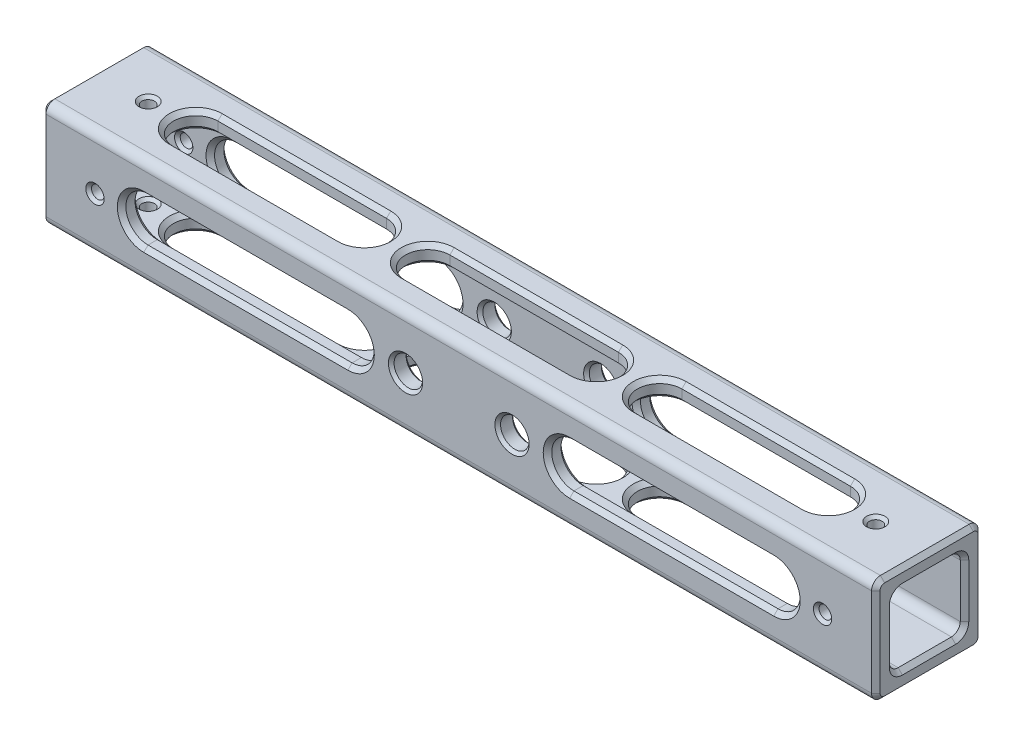
from build123d import *

# Parameters (mm, degrees)
SKETCH1_W                          = 19.05
SKETCH1_H                          = 19.05
SKETCH1_W_2                        = 12.7
SKETCH1_H_2                        = 12.7
BOSS_EXTRUDE1_DEPTH                = 74.6125
F_1_4_20_TAPPED_HOLE1_D            = 5.1054
F_4_40_TAPPED_HOLE1_D              = 2.2606
F_4_40_TAPPED_HOLE2_D              = 2.2606
F_5_16_START                       = -9.525
F_5_16_0_3125_DIAMETER_SLOT1_DEPTH = 19.05
F_5_16_0_3125_DIAMETER_SLOT2_DEPTH = 19.05
FILLET1_R                          = 1.5875
CHAMFER2_SIZE                      = 0.762
CHAMFER1_SIZE                      = 0.508


# Read off the part's stored shape, not the designer's step: 5/16 (0.3125) Diameter Slot1, 5/16 (0.3125) Diameter Slot2
with BuildPart() as part:
    # Sketch1 → Boss-Extrude1 (new, symmetric)
    with BuildSketch(Plane(origin=(0, 0, 0), x_dir=(0, 0, -1), z_dir=(1, 0, 0))):
        Rectangle(SKETCH1_W, SKETCH1_H)
        Rectangle(SKETCH1_W_2, SKETCH1_H_2, mode=Mode.SUBTRACT)
    extrude(amount=BOSS_EXTRUDE1_DEPTH, both=True)

    # 1/4-20 Tapped Hole1 (through all)
    with Locations(Plane.XY.offset(9.525)):
        with Locations((-9.525, 0), (9.525, 0)):
            Hole(F_1_4_20_TAPPED_HOLE1_D / 2)

    # #4-40 Tapped Hole1 (through all)
    with Locations(Plane.XY.offset(9.525)):
        with Locations((65.0875, 0), (-65.0875, 0)):
            Hole(F_4_40_TAPPED_HOLE1_D / 2)

    # #4-40 Tapped Hole2 (through all)
    with Locations(Plane(origin=(0, 9.525, 0), x_dir=(1, 0, 0), z_dir=(0, 1, 0))):
        with Locations((65.0875, 0), (-65.0875, 0)):
            Hole(F_4_40_TAPPED_HOLE2_D / 2)

    # 5/16 (0.3125) Diameter Slot1 outline → 5/16 (0.3125) Diameter Slot1 (cut)
    with BuildSketch(Plane.XY.offset(F_5_16_START)):
        with BuildLine():
            ThreePointArc((56.35625, -3.96875), (60.325, 0), (56.35625, 3.96875))
            Line((56.35625, 3.96875), (19.84375, 3.96875))
            ThreePointArc((19.84375, 3.96875), (15.875, 0), (19.84375, -3.96875))
            Line((19.84375, -3.96875), (56.35625, -3.96875))
        make_face()
        with BuildLine():
            ThreePointArc((-19.84375, -3.96875), (-15.875, 0), (-19.84375, 3.96875))
            Line((-19.84375, 3.96875), (-56.35625, 3.96875))
            ThreePointArc((-56.35625, 3.96875), (-60.325, 0), (-56.35625, -3.96875))
            Line((-56.35625, -3.96875), (-19.84375, -3.96875))
        make_face()
    extrude(amount=F_5_16_0_3125_DIAMETER_SLOT1_DEPTH, mode=Mode.SUBTRACT)

    # 5/16 (0.3125) Diameter Slot2 outline → 5/16 (0.3125) Diameter Slot2 (cut)
    with BuildSketch(Plane(origin=(0, 0, 0), x_dir=(1, 0, 0), z_dir=(0, 1, 0)).offset(F_5_16_START)):
        with BuildLine():
            ThreePointArc((26.42235, 3.96875), (22.4536, 0), (26.42235, -3.96875))
            Line((26.42235, -3.96875), (56.58485, -3.96875))
            ThreePointArc((56.58485, -3.96875), (60.5536, 0), (56.58485, 3.96875))
            Line((56.58485, 3.96875), (26.42235, 3.96875))
        make_face()
        with BuildLine():
            ThreePointArc((-26.42235, -3.96875), (-22.4536, 0), (-26.42235, 3.96875))
            Line((-26.42235, 3.96875), (-56.58485, 3.96875))
            ThreePointArc((-56.58485, 3.96875), (-60.5536, 0), (-56.58485, -3.96875))
            Line((-56.58485, -3.96875), (-26.42235, -3.96875))
        make_face()
        with BuildLine():
            ThreePointArc((15.08125, -3.96875), (19.05, 0), (15.08125, 3.96875))
            Line((15.08125, 3.96875), (-15.08125, 3.96875))
            ThreePointArc((-15.08125, 3.96875), (-19.05, 0), (-15.08125, -3.96875))
            Line((-15.08125, -3.96875), (15.08125, -3.96875))
        make_face()
    extrude(amount=F_5_16_0_3125_DIAMETER_SLOT2_DEPTH, mode=Mode.SUBTRACT)

    # Fillet1
    fillet1_edges = [part.edges().sort_by_distance(p)[0] for p in [
        (0, -6.35, -6.35),
        (0, 6.35, -6.35),
        (0, 6.35, 6.35),
        (0, -6.35, 6.35),
        (0, -9.525, -9.525),
        (0, -9.525, 9.525),
        (0, 9.525, 9.525),
        (0, 9.525, -9.525),
    ]]
    fillet(fillet1_edges, radius=FILLET1_R)

    # Chamfer2
    chamfer2_edges = [part.edges().sort_by_distance(p)[0] for p in [
        (15.875, 0, 9.525),
        (38.1, 3.96875, -9.525),
        (-38.1, 3.96875, 6.35),
        (-15.875, 0, 6.35),
        (-38.1, -3.96875, 6.35),
        (-15.875, 0, -6.35),
        (-15.875, 0, -9.525),
        (-38.1, -3.96875, -6.35),
        (-38.1, -3.96875, -9.525),
        (-38.1, 3.96875, -6.35),
        (-60.325, 0, -6.35),
        (-60.325, 0, 6.35),
        (-60.325, 0, -9.525),
        (-38.1, -3.96875, 9.525),
        (-15.875, 0, 9.525),
        (-60.325, 0, 9.525),
        (-38.1, 3.96875, -9.525),
        (-38.1, 3.96875, 9.525),
        (41.5036, -6.35, -3.96875),
        (60.5536, -6.35, 0),
        (22.4536, -6.35, 0),
        (41.5036, -6.35, 3.96875),
        (60.5536, 6.35, 0),
        (41.5036, 6.35, 3.96875),
        (22.4536, 6.35, 0),
        (22.4536, 9.525, 0),
        (41.5036, 6.35, -3.96875),
        (41.5036, 9.525, -3.96875),
        (41.5036, -9.525, -3.96875),
        (60.5536, -9.525, 0),
        (22.4536, -9.525, 0),
        (41.5036, 9.525, 3.96875),
        (60.5536, 9.525, 0),
        (41.5036, -9.525, 3.96875),
        (-41.5036, 6.35, -3.96875),
        (-22.4536, 6.35, 0),
        (-60.5536, 6.35, 0),
        (-41.5036, 6.35, 3.96875),
        (-60.5536, -6.35, 0),
        (-22.4536, -6.35, 0),
        (-22.4536, 9.525, 0),
        (-60.5536, 9.525, 0),
        (-41.5036, -6.35, 3.96875),
        (-41.5036, -9.525, 3.96875),
        (-41.5036, -6.35, -3.96875),
        (-41.5036, -9.525, -3.96875),
        (-22.4536, -9.525, 0),
        (-60.5536, -9.525, 0),
        (-41.5036, 9.525, 3.96875),
        (-41.5036, 9.525, -3.96875),
        (-19.05, -6.35, 0),
        (19.05, -6.35, 0),
        (0, -6.35, -3.96875),
        (0, 6.35, -3.96875),
        (0, 9.525, -3.96875),
        (19.05, 6.35, 0),
        (19.05, 9.525, 0),
        (-19.05, 6.35, 0),
        (-19.05, 9.525, 0),
        (0, 6.35, 3.96875),
        (0, -6.35, 3.96875),
        (0, -9.525, -3.96875),
        (19.05, -9.525, 0),
        (-19.05, -9.525, 0),
        (0, 9.525, 3.96875),
        (0, -9.525, 3.96875),
        (-74.6125, 0, -6.35),
        (74.6125, 0, -6.35),
        (-74.6125, 6.35, 0),
        (74.6125, 6.35, 0),
        (-74.6125, -6.35, 0),
        (74.6125, -6.35, 0),
        (-74.6125, 0, 6.35),
        (74.6125, 0, 6.35),
        (-74.6125, 0, -9.525),
        (74.6125, 0, -9.525),
        (-74.6125, -9.525, 0),
        (-74.6125, 0, 9.525),
        (-74.6125, 9.525, 0),
        (-74.6125, 9.060032015, 9.060032015),
        (-74.6125, 9.060032015, -9.060032015),
        (-74.6125, -9.060032015, 9.060032015),
        (-74.6125, -9.060032015, -9.060032015),
        (74.6125, -9.525, 0),
        (74.6125, 9.525, 0),
        (74.6125, 0, 9.525),
        (74.6125, 9.060032015, 9.060032015),
        (74.6125, 9.060032015, -9.060032015),
        (74.6125, -9.060032015, 9.060032015),
        (74.6125, -9.060032015, -9.060032015),
        (-74.6125, 5.885032015, -5.885032015),
        (74.6125, 5.885032015, -5.885032015),
        (-74.6125, -5.885032015, -5.885032015),
        (74.6125, -5.885032015, -5.885032015),
        (-74.6125, -5.885032015, 5.885032015),
        (74.6125, -5.885032015, 5.885032015),
        (-74.6125, 5.885032015, 5.885032015),
        (74.6125, 5.885032015, 5.885032015),
        (38.1, 3.96875, -6.35),
        (60.325, 0, -6.35),
        (38.1, -3.96875, -6.35),
        (15.875, 0, -6.35),
        (38.1, -3.96875, 6.35),
        (60.325, 0, 6.35),
        (15.875, 0, 6.35),
        (15.875, 0, -9.525),
        (60.325, 0, -9.525),
        (38.1, -3.96875, -9.525),
        (38.1, 3.96875, 6.35),
        (38.1, 3.96875, 9.525),
        (38.1, -3.96875, 9.525),
        (60.325, 0, 9.525),
    ]]
    chamfer(chamfer2_edges, length=CHAMFER2_SIZE)

    # Chamfer1
    chamfer1_edges = [part.edges().sort_by_distance(p)[0] for p in [
        (12.0777, 0, 6.35),
        (12.0777, 0, -6.35),
        (12.0777, 0, -9.525),
        (12.0777, 0, 9.525),
        (-6.9723, 0, -6.35),
        (-6.9723, 0, 6.35),
        (-6.9723, 0, 9.525),
        (-6.9723, 0, -9.525),
        (-63.9572, 0, 6.35),
        (-63.9572, 0, -6.35),
        (-63.9572, 0, -9.525),
        (-63.9572, 0, 9.525),
        (66.2178, 0, 6.35),
        (66.2178, 0, -6.35),
        (66.2178, 0, -9.525),
        (66.2178, 0, 9.525),
        (-63.9572, -6.35, 0),
        (-63.9572, 6.35, 0),
        (-63.9572, 9.525, 0),
        (-63.9572, -9.525, 0),
        (66.2178, 6.35, 0),
        (66.2178, -6.35, 0),
        (66.2178, -9.525, 0),
        (66.2178, 9.525, 0),
    ]]
    chamfer(chamfer1_edges, length=CHAMFER1_SIZE)


solid = part.part
